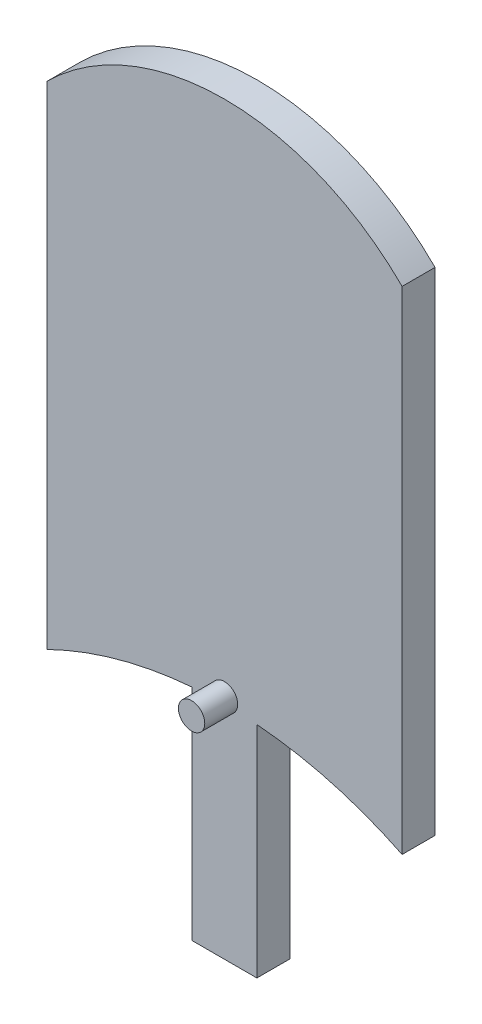
from build123d import *
from build123d.topology import SkipClean

# Parameters (mm, degrees)
BOSS_EXTRUDE1_DEPTH = 3.175
BOSS_EXTRUDE2_START = 3.175
BOSS_EXTRUDE2_DEPTH = 3.175
SKETCH3_W           = 6.236959702
SKETCH3_H           = 41.352711554
BOSS_EXTRUDE3_DEPTH = 3.175
BOSS_EXTRUDE4_DEPTH = 3.175
BOSS_EXTRUDE5_REACH = 47.548
SKETCH6_W           = 1.016
SKETCH6_H           = 43.066281197
CUT_EXTRUDE1_REACH  = 47.451


with BuildPart() as part:
    # Sketch1 → Boss-Extrude1 (new body)
    with BuildSketch(Plane.XY):
        with BuildLine():
            Line((-17.114253333, 23.707583903), (-17.114253333, -23.707583903))
            ThreePointArc((-17.114253333, -23.707583903), (0, -19.732802645), (17.114253333, -23.707583903))
            Line((17.114253333, -23.707583903), (17.114253333, 23.707583903))
            ThreePointArc((17.114253333, 23.707583903), (0, 30.782200079), (-17.114253333, 23.707583903))
        make_face()
    extrude(amount=BOSS_EXTRUDE1_DEPTH)

    # Sketch2 → Boss-Extrude2 (add)
    with SkipClean():  # the faces are left unmerged after this step: merging them gives an invalid solid
        with BuildSketch(Plane(origin=(0, 0, 0), x_dir=(-1, 0, 0), z_dir=(0, 0, -1)).offset(BOSS_EXTRUDE2_START)):
            with BuildLine():
                Line((1.65128862, 23.29835294), (1.65128862, -19.767928257))
                ThreePointArc((1.65128862, -19.767928257), (2.25262846, -19.798194915), (2.853426735, -19.837781624))
                Line((2.853426735, -19.837781624), (2.853426735, 23.29835294))
                Line((2.853426735, 23.29835294), (1.65128862, 23.29835294))
            make_face()
            with BuildLine():
                Line((-1.65128862, -19.767928257), (-1.65128862, 23.29835294))
                Line((-1.65128862, 23.29835294), (-2.853426735, 23.29835294))
                Line((-2.853426735, 23.29835294), (-2.853426735, -19.837781624))
                ThreePointArc((-2.853426735, -19.837781624), (-2.25262846, -19.798194915), (-1.65128862, -19.767928257))
            make_face()
        extrude(amount=-BOSS_EXTRUDE2_DEPTH)

    # Sketch3 → Boss-Extrude3 (add)
    with BuildSketch(Plane.XY.offset(3.175)):
        with Locations((0, -20.33746726)):
            Rectangle(SKETCH3_W, SKETCH3_H)
    extrude(amount=-BOSS_EXTRUDE3_DEPTH)

    # Sketch4 → Boss-Extrude4 (add)
    with BuildSketch(Plane.XY.offset(3.175)):
        with BuildLine():
            ThreePointArc((0, -20.375823038), (0.898025612, -20.003848651), (1.27, -19.105823038))
            ThreePointArc((1.27, -19.105823038), (-0.898025612, -18.207797426), (0, -20.375823038))
        make_face()
    extrude(amount=BOSS_EXTRUDE4_DEPTH)

    # Sketch6 → Boss-Extrude5 (add, up to next)
    with BuildSketch(Plane.ZY.offset(-1.65128862), mode=Mode.PRIVATE) as boss_extrude5_sk1:
        with Locations((-2.667, 1.765212341)):
            Rectangle(SKETCH6_W, SKETCH6_H)
    boss_extrude5_tool1 = extrude(boss_extrude5_sk1.sketch, amount=BOSS_EXTRUDE5_REACH, mode=Mode.PRIVATE) - part.part
    add(boss_extrude5_tool1.solids().sort_by_distance((1.651289, 1.765212, -2.667))[0])

    # Sketch8 → Cut-Extrude1 (cut, up to next)
    with BuildSketch(Plane(origin=(0, 0, -3.175), x_dir=(-1, 0, 0), z_dir=(0, 0, -1)), mode=Mode.PRIVATE) as cut_extrude1_sk1:
        Polygon((0, 23.29835294), (-0.9525, 23.29835294), (-0.9525, -19.767928257), (0.9525, -19.767928257), (0.9525, 23.29835294), align=None)
    cut_extrude1_tool1 = extrude(cut_extrude1_sk1.sketch, amount=-CUT_EXTRUDE1_REACH, mode=Mode.PRIVATE) & part.part
    add(cut_extrude1_tool1.solids().sort_by_distance((0, 1.765212, -3.175))[0], mode=Mode.SUBTRACT)


solid = part.part
